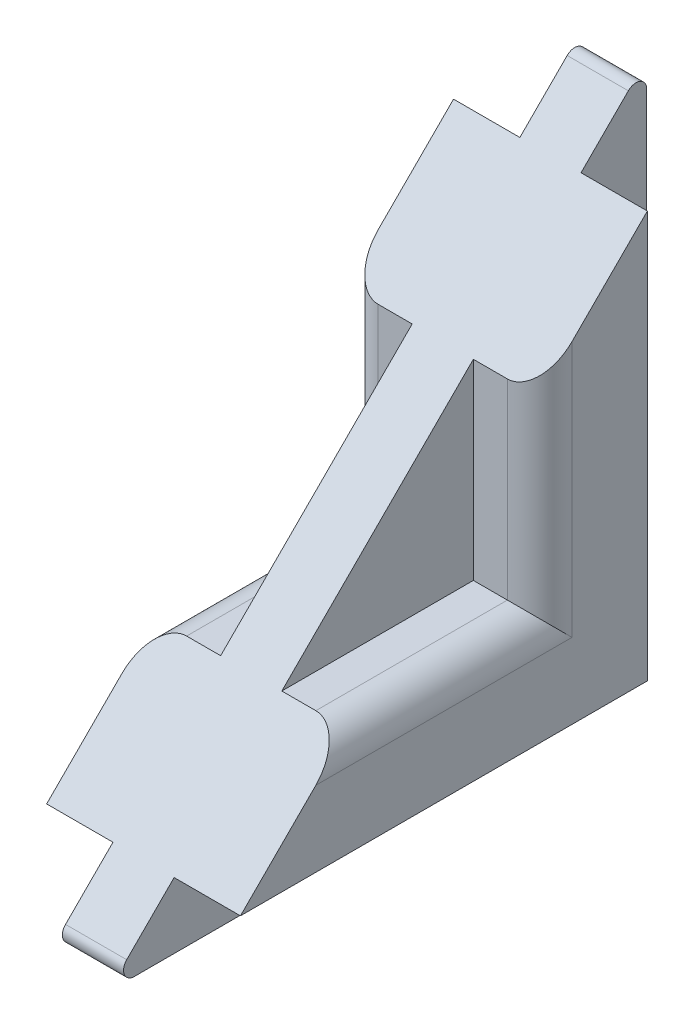
from build123d import *

# Parameters (mm, degrees)
SKETCH1_R           = 2.1
BOSS_EXTRUDE1_DEPTH = 1
FILLET1_R           = 1
BOSS_EXTRUDE2_DEPTH = 2.84
BOSS_EXTRUDE3_REACH = 76.197
SKETCH9_W           = 18
SKETCH9_H           = 10
SKETCH10_W          = 6.16
SKETCH10_H          = 10
SKETCH10_H_2        = 10.013009375
CUT_EXTRUDE1_DEPTH  = 6.1
BOSS_EXTRUDE4_START = -9
BOSS_EXTRUDE4_DEPTH = 18
CUT_EXTRUDE3_DEPTH  = 75.197102369
FILLET3_R           = 3
FILLET4_R           = 3
FILLET5_R           = 3
FILLET6_R           = 1
FILLET7_R           = 1


# Read off the part's stored shape, not the designer's step: Boss-Extrude4
with BuildPart() as part:
    # Sketch1 → Boss-Extrude1 (new body)
    with BuildSketch(Plane.XY):
        with BuildLine():
            Line((-2.839339828, 3.9), (-5.470710678, 6.53137085))
            ThreePointArc((-5.470710678, 6.53137085), (-5.492387953, 6.563813185), (-5.5, 6.602081528))
            Line((-5.5, 6.602081528), (-5.5, 8.1))
            ThreePointArc((-5.5, 8.1), (-5.470710678, 8.170710678), (-5.4, 8.2))
            Line((-5.4, 8.2), (-3.334418044, 8.2))
            ThreePointArc((-3.334418044, 8.2), (-3.244178397, 8.256909326), (-3.2566483, 8.362863876))
            Line((-3.2566483, 8.362863876), (-4.58, 10))
            Line((-4.58, 10), (-10, 10))
            Line((-10, 10), (-10, 4.58))
            Line((-10, 4.58), (-8.362863876, 3.2566483))
            ThreePointArc((-8.362863876, 3.2566483), (-8.256909326, 3.244178397), (-8.2, 3.334418044))
            Line((-8.2, 3.334418044), (-8.2, 5.4))
            ThreePointArc((-8.2, 5.4), (-8.170710678, 5.470710678), (-8.1, 5.5))
            Line((-8.1, 5.5), (-6.602081528, 5.5))
            ThreePointArc((-6.602081528, 5.5), (-6.563813185, 5.492387953), (-6.53137085, 5.470710678))
            Line((-6.53137085, 5.470710678), (-3.9, 2.839339828))
            Line((-3.9, 2.839339828), (-3.9, -2.839339828))
            Line((-3.9, -2.839339828), (-6.53137085, -5.470710678))
            ThreePointArc((-6.53137085, -5.470710678), (-6.563813185, -5.492387953), (-6.602081528, -5.5))
            Line((-6.602081528, -5.5), (-8.1, -5.5))
            ThreePointArc((-8.1, -5.5), (-8.170710678, -5.470710678), (-8.2, -5.4))
            Line((-8.2, -5.4), (-8.2, -3.334418044))
            ThreePointArc((-8.2, -3.334418044), (-8.256909326, -3.244178397), (-8.362863876, -3.2566483))
            Line((-8.362863876, -3.2566483), (-10, -4.58))
            Line((-10, -4.58), (-10, -10))
            Line((-10, -10), (-4.58, -10))
            Line((-4.58, -10), (-3.2566483, -8.362863876))
            ThreePointArc((-3.2566483, -8.362863876), (-3.244178397, -8.256909326), (-3.334418044, -8.2))
            Line((-3.334418044, -8.2), (-5.4, -8.2))
            ThreePointArc((-5.4, -8.2), (-5.470710678, -8.170710678), (-5.5, -8.1))
            Line((-5.5, -8.1), (-5.5, -6.602081528))
            ThreePointArc((-5.5, -6.602081528), (-5.492387953, -6.563813185), (-5.470710678, -6.53137085))
            Line((-5.470710678, -6.53137085), (-2.839339828, -3.9))
            Line((-2.839339828, -3.9), (2.839339828, -3.9))
            Line((2.839339828, -3.9), (5.470710678, -6.53137085))
            ThreePointArc((5.470710678, -6.53137085), (5.492387953, -6.563813185), (5.5, -6.602081528))
            Line((5.5, -6.602081528), (5.5, -8.1))
            ThreePointArc((5.5, -8.1), (5.470710678, -8.170710678), (5.4, -8.2))
            Line((5.4, -8.2), (3.334418044, -8.2))
            ThreePointArc((3.334418044, -8.2), (3.244178397, -8.256909326), (3.2566483, -8.362863876))
            Line((3.2566483, -8.362863876), (4.58, -10))
            Line((4.58, -10), (10, -10))
            Line((10, -10), (10, -4.58))
            Line((10, -4.58), (8.362863876, -3.2566483))
            ThreePointArc((8.362863876, -3.2566483), (8.256909326, -3.244178397), (8.2, -3.334418044))
            Line((8.2, -3.334418044), (8.2, -5.4))
            ThreePointArc((8.2, -5.4), (8.170710678, -5.470710678), (8.1, -5.5))
            Line((8.1, -5.5), (6.602081528, -5.5))
            ThreePointArc((6.602081528, -5.5), (6.563813185, -5.492387953), (6.53137085, -5.470710678))
            Line((6.53137085, -5.470710678), (3.9, -2.839339828))
            Line((3.9, -2.839339828), (3.9, 2.839339828))
            Line((3.9, 2.839339828), (6.53137085, 5.470710678))
            ThreePointArc((6.53137085, 5.470710678), (6.563813185, 5.492387953), (6.602081528, 5.5))
            Line((6.602081528, 5.5), (8.1, 5.5))
            ThreePointArc((8.1, 5.5), (8.170710678, 5.470710678), (8.2, 5.4))
            Line((8.2, 5.4), (8.2, 3.334418044))
            ThreePointArc((8.2, 3.334418044), (8.256909326, 3.244178397), (8.362863876, 3.2566483))
            Line((8.362863876, 3.2566483), (10, 4.58))
            Line((10, 4.58), (10, 10))
            Line((10, 10), (4.58, 10))
            Line((4.58, 10), (3.2566483, 8.362863876))
            ThreePointArc((3.2566483, 8.362863876), (3.244178397, 8.256909326), (3.334418044, 8.2))
            Line((3.334418044, 8.2), (5.4, 8.2))
            ThreePointArc((5.4, 8.2), (5.470710678, 8.170710678), (5.5, 8.1))
            Line((5.5, 8.1), (5.5, 6.602081528))
            ThreePointArc((5.5, 6.602081528), (5.492387953, 6.563813185), (5.470710678, 6.53137085))
            Line((5.470710678, 6.53137085), (2.839339828, 3.9))
            Line((2.839339828, 3.9), (-2.839339828, 3.9))
        make_face()
        Circle(SKETCH1_R, mode=Mode.SUBTRACT)
    extrude(amount=BOSS_EXTRUDE1_DEPTH)

    # Fillet1
    fillet1_edges = [part.edges().sort_by_distance(p)[0] for p in [
        (10, -10, 0.5),
        (-10, -10, 0.5),
        (-10, 10, 0.5),
        (10, 10, 0.5),
    ]]
    fillet(fillet1_edges, radius=FILLET1_R)


with BuildPart() as body_2:
    # 3DSketch1 → Boss-Extrude2 (new, symmetric)
    with BuildSketch(Plane(origin=(0, 3.9, 1), x_dir=(0, 0.7071067811865477, -0.7071067811865475), z_dir=(-1, 0, 0))):
        Polygon((0, 0), (70.710678119, 0), (35.355339059, 35.355339059), align=None)
    extrude(amount=BOSS_EXTRUDE2_DEPTH, both=True)

    # Boss-Extrude3: up to this plane
    boss_extrude3_end = Plane(origin=(2.84, 3.9, 1), z_dir=(0, 0.7071067811865475, 0.7071067811865476))
    # Sketch9 → Boss-Extrude3 (add, up to the surface)
    with BuildSketch(Plane(origin=(0, 0, -49), x_dir=(-1, 0, 0), z_dir=(0, 0, -1)), mode=Mode.PRIVATE) as boss_extrude3_sk1:
        with Locations((0, 15.013009375)):
            Rectangle(SKETCH9_W, SKETCH9_H)
    boss_extrude3_tool1 = split(extrude(boss_extrude3_sk1.sketch, amount=-BOSS_EXTRUDE3_REACH, mode=Mode.PRIVATE), bisect_by=boss_extrude3_end, keep=Keep.BOTH, mode=Mode.PRIVATE)
    add(boss_extrude3_tool1.solids().sort_by_distance((0, 15.013009, -49))[0])

    # Sketch10 → Cut-Extrude1 (cut)
    with BuildSketch(Plane(origin=(0, 0, -49), x_dir=(-1, 0, 0), z_dir=(0, 0, -1))):
        with Locations((-5.92, 15.013009375)):
            Rectangle(SKETCH10_W, SKETCH10_H)
        with Locations((5.92, 15.006504688)):
            Rectangle(SKETCH10_W, SKETCH10_H_2)
    extrude(amount=-CUT_EXTRUDE1_DEPTH, mode=Mode.SUBTRACT)

    # Boss-Extrude4 outline → Boss-Extrude4 (add)
    with BuildSketch(Plane.YZ.offset(BOSS_EXTRUDE4_START)):
        Polygon((20.013009375, -42.9), (47.8, -42.9), (37.8, -32.9), (20.013009375, -32.9), align=None)
    extrude(amount=BOSS_EXTRUDE4_DEPTH)


with BuildPart() as cut_extrude3_tool:
    # Sketch13 → Cut-Extrude3 (new, through all)
    with BuildSketch(Plane.XY.offset(1)):
        Polygon((-2.839339828, 3.9), (2.839339828, 3.9), (2.84, 10.013009375), (10.658445574, 10.013009375), (10.658445574, -10.0708852), (-2.84, -10.0708852), (-10.475035235, -10.0708852), (-10.475035235, 10.013009375), (-2.84, 10.013009375), align=None)
    extrude(amount=-CUT_EXTRUDE3_DEPTH)


with BuildPart() as part_1:
    add(part.part)

    # Cut-Extrude3: cut by cut_extrude3_tool
    add(cut_extrude3_tool.part, mode=Mode.SUBTRACT)


with BuildPart() as body_2_1:
    add(body_2.part)

    # Cut-Extrude3: cut by cut_extrude3_tool
    add(cut_extrude3_tool.part, mode=Mode.SUBTRACT)

    # Fillet3
    fillet3_edges = [body_2_1.edges().sort_by_distance(p)[0] for p in [
        (9, 20.013009375, -24.006504687),
    ]]
    fillet(fillet3_edges, radius=FILLET3_R)

    # Fillet4
    fillet4_edges = [body_2_1.edges().sort_by_distance(p)[0] for p in [
        (-9, 20.013009375, -24.006504687),
    ]]
    fillet(fillet4_edges, radius=FILLET4_R)

    # Fillet5
    fillet5_edges = [body_2_1.edges().sort_by_distance(p)[0] for p in [
        (9, 27.406504687, -32.9),
        (-9, 27.406504687, -32.9),
    ]]
    fillet(fillet5_edges, radius=FILLET5_R)

    # Fillet6
    fillet6_edges = [body_2_1.edges().sort_by_distance(p)[0] for p in [
        (0, 53.9, -49),
        (0, 3.9, 1),
    ]]
    fillet(fillet6_edges, radius=FILLET6_R)

    # Fillet7
    fillet7_edges = [body_2_1.edges().sort_by_distance(p)[0] for p in [
        (0, 3.9, -49),
    ]]
    fillet(fillet7_edges, radius=FILLET7_R)


solid = body_2_1.part
